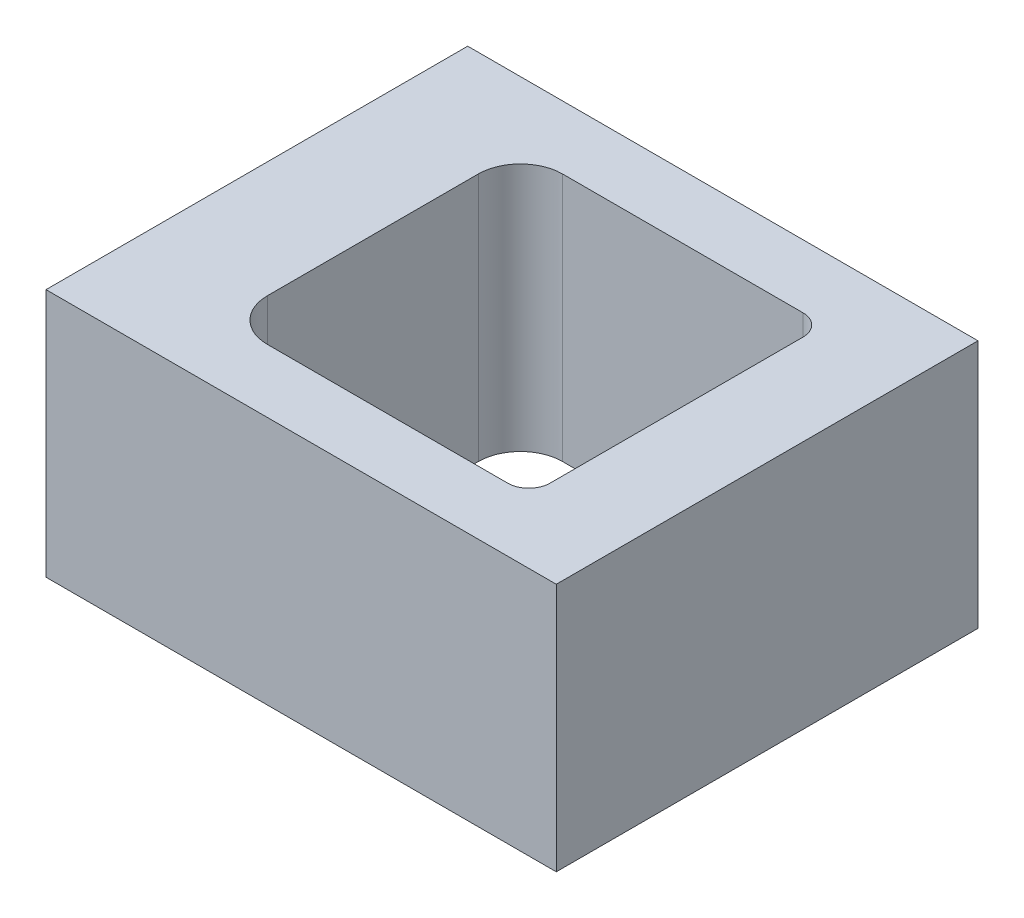
from build123d import *

# Parameters (mm, degrees)
SKETCH1_W           = 153.67
SKETCH1_H           = 127
BOSS_EXTRUDE1_DEPTH = 75.0062


with BuildPart() as part:
    # Sketch1 → Boss-Extrude1 (new body)
    with BuildSketch(Plane(origin=(0, 0, 0), x_dir=(1, 0, 0), z_dir=(0, 1, 0))):
        Rectangle(SKETCH1_W, SKETCH1_H)
        with BuildLine():
            Line((-41.91, 31.75), (-41.91, -31.75))
            ThreePointArc((-41.91, -31.75), (-38.190256121, -40.730256121), (-29.21, -44.45))
            Line((-29.21, -44.45), (43.18, -44.45))
            ThreePointArc((43.18, -44.45), (47.670128061, -42.590128061), (49.53, -38.1))
            Line((49.53, -38.1), (49.53, 38.1))
            ThreePointArc((49.53, 38.1), (47.670128061, 42.590128061), (43.18, 44.45))
            Line((43.18, 44.45), (-29.21, 44.45))
            ThreePointArc((-29.21, 44.45), (-38.190256121, 40.730256121), (-41.91, 31.75))
        make_face(mode=Mode.SUBTRACT)
    extrude(amount=BOSS_EXTRUDE1_DEPTH)


solid = part.part
